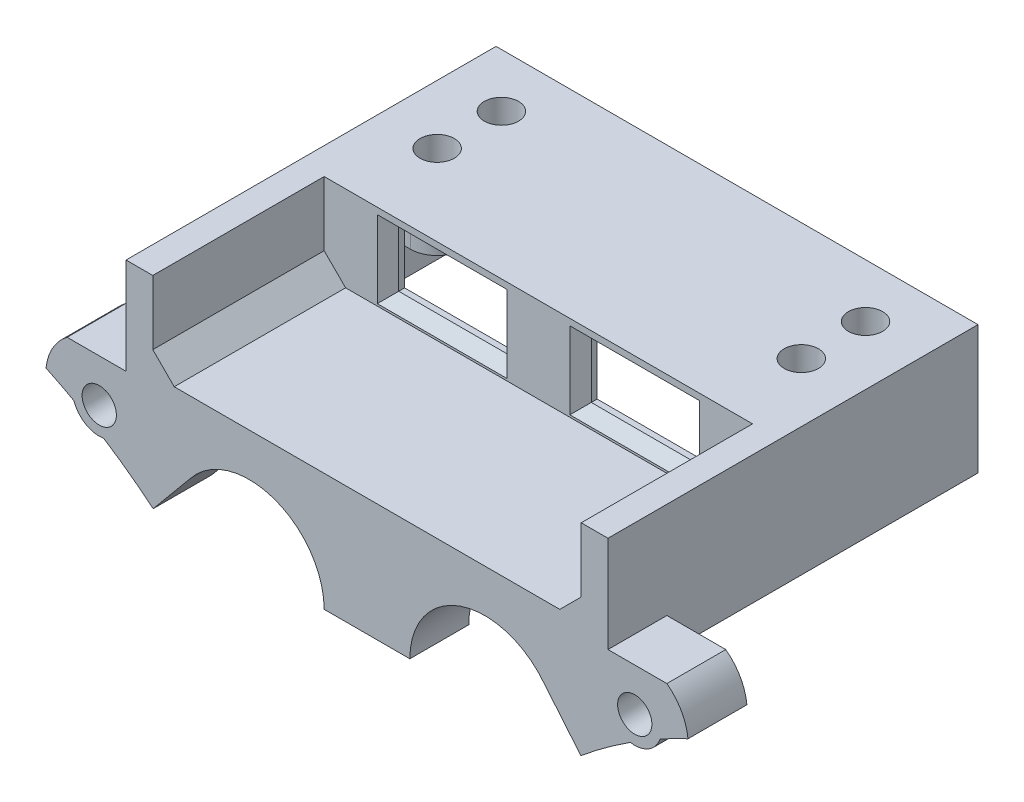
from build123d import *

# Parameters (mm, degrees)
EXTRUDE_1_DEPTH     = 34.55
SKETCH_2_W          = 40
SKETCH_2_H          = 8
CUT_EXTRUDE_1_DEPTH = 16
CUT_EXTRUDE_2_DEPTH = 10
SKETCH_4_W          = 10.1
SKETCH_4_H          = 5.2
CUT_EXTRUDE_3_DEPTH = 10
CHAMFER_1_SIZE      = 2
CHAMFER_2_SIZE      = 1
SKETCH_6_R          = 1.6
EXTRUDE_2_DEPTH     = 6.9
SKETCH_7_R          = 1.6
CUT_EXTRUDE_4_DEPTH = 10
SKETCH_8_R          = 1.6
EXTRUDE_3_DEPTH     = 5.5
SKETCH_10_W         = 40
SKETCH_10_H         = 10
CUT_EXTRUDE_5_DEPTH = 2
CUT_EXTRUDE_6_DEPTH = 10


with BuildPart() as part:
    # 草图1 → 凸台-拉伸1 (new body)
    with BuildSketch(Plane.XY):
        Polygon((0, 0), (22.5, 0), (22.5, 12), (-22.5, 12), (-22.5, 0), align=None)
    extrude(amount=EXTRUDE_1_DEPTH)

    # 草图2 → 切除-拉伸1 (cut)
    with BuildSketch(Plane.XY.offset(34.55)):
        with Locations((0, 8)):
            Rectangle(SKETCH_2_W, SKETCH_2_H)
    extrude(amount=-CUT_EXTRUDE_1_DEPTH, mode=Mode.SUBTRACT)

    # 草图3 → 切除-拉伸2 (cut)
    with BuildSketch(Plane.XZ):
        Polygon((0, 2), (20, 2), (20, 17), (-20, 17), (-20, 2), align=None)
    extrude(amount=-CUT_EXTRUDE_2_DEPTH, mode=Mode.SUBTRACT)

    # 草图4 → 切除-拉伸3 (cut)
    with BuildSketch(Plane.XY.offset(18.55)):
        with Locations((-8.99, 7.8)):
            Rectangle(SKETCH_4_W, SKETCH_4_H)
        with Locations((8.99, 7.8)):
            Rectangle(SKETCH_4_W, SKETCH_4_H)
    extrude(amount=-CUT_EXTRUDE_3_DEPTH, mode=Mode.SUBTRACT)

    # 倒角1
    chamfer_1_edges = [part.edges().sort_by_distance(p)[0] for p in [
        (20, 4, 26.55),
        (-20, 4, 26.55),
    ]]
    chamfer(chamfer_1_edges, length=CHAMFER_1_SIZE)

    # 倒角2
    chamfer_2_edges = [part.edges().sort_by_distance(p)[0] for p in [
        (-8.99, 5.2, 18.55),
        (-14.04, 7.8, 18.55),
        (-8.99, 10.4, 18.55),
        (-3.94, 7.8, 18.55),
        (8.99, 10.4, 18.55),
        (3.94, 7.8, 18.55),
        (8.99, 5.2, 18.55),
        (14.04, 7.8, 18.55),
    ]]
    chamfer(chamfer_2_edges, length=CHAMFER_2_SIZE)

    # 草图6 → 凸台-拉伸2 (add)
    # profile 1 of 2: a face of its own
    with BuildSketch(Plane(origin=(0, 12, 0), x_dir=(1, 0, 0), z_dir=(0, 1, 0))):
        with BuildLine():
            Line((22.5, 0), (22.5, -13.5))
            Line((22.5, -13.5), (17, -13.5))
            ThreePointArc((17, -13.5), (15.232233047, -12.767766953), (14.5, -11))
            Line((14.5, -11), (14.5, -5))
            Line((14.5, -5), (14.5, 0))
            Line((14.5, 0), (22.5, 0))
        make_face()
        with Locations((17, -5)):
            Circle(SKETCH_6_R, mode=Mode.SUBTRACT)
        with Locations((17, -11)):
            Circle(SKETCH_6_R, mode=Mode.SUBTRACT)
    # profile 2 of 2: a face of its own
    with BuildSketch(Plane(origin=(0, 12, 0), x_dir=(1, 0, 0), z_dir=(0, 1, 0))):
        with BuildLine():
            Line((-14.5, 0), (-22.5, 0))
            Line((-22.5, 0), (-22.5, -13.5))
            Line((-22.5, -13.5), (-17, -13.5))
            ThreePointArc((-17, -13.5), (-15.232233047, -12.767766953), (-14.5, -11))
            Line((-14.5, -11), (-14.5, -5))
            Line((-14.5, -5), (-14.5, 0))
        make_face()
        with Locations((-17, -11)):
            Circle(SKETCH_6_R, mode=Mode.SUBTRACT)
        with Locations((-17, -5)):
            Circle(SKETCH_6_R, mode=Mode.SUBTRACT)
    extrude(amount=-EXTRUDE_2_DEPTH)

    # 草图7 → 切除-拉伸4 (cut)
    with BuildSketch(Plane(origin=(0, 12, 0), x_dir=(1, 0, 0), z_dir=(0, 1, 0))):
        with Locations((17, -5)):
            Circle(SKETCH_7_R)
        with Locations((17, -11)):
            Circle(SKETCH_7_R)
        with Locations((-17, -5)):
            Circle(SKETCH_7_R)
        with Locations((-17, -11)):
            Circle(SKETCH_7_R)
    extrude(amount=-CUT_EXTRUDE_4_DEPTH, mode=Mode.SUBTRACT)

    # 草图8 → 凸台-拉伸3 (add)
    with BuildSketch(Plane.XY.offset(34.55)):
        with BuildLine():
            Line((1.843049286, -25.367101461), (9.230566594, -19.615105309))
            ThreePointArc((9.230566594, -19.615105309), (9.814108465, -18.625953935), (10.421644381, -17.651355727))
            Line((10.421644381, -17.651355727), (5.476763257, -11.300448334))
            ThreePointArc((5.476763257, -11.300448334), (6.699551666, -1.476763257), (16.523236743, -2.699551666))
            Line((16.523236743, -2.699551666), (19.967990067, -6.846461039))
            ThreePointArc((19.967990067, -6.846461039), (22.224318463, -5.085470923), (24.58365332, -3.465087309))
            ThreePointArc((24.58365332, -3.465087309), (26.278709649, -3.148232211), (27.365383934, -1.809295278))
            ThreePointArc((27.365383934, -1.809295278), (28.658809968, -1.124546474), (29.972928279, -0.480399834))
            ThreePointArc((29.972928279, -0.480399834), (29.349734714, 1.46572665), (28, 3))
            Line((28, 3), (22.5, 3))
            Line((22.5, 3), (22.5, 4))
            Line((22.5, 4), (-22.5, 4))
            Line((-22.5, 4), (-22.5, 3))
            Line((-22.5, 3), (-28, 3))
            ThreePointArc((-28, 3), (-29.349734714, 1.46572665), (-29.972928279, -0.480399834))
            ThreePointArc((-29.972928279, -0.480399834), (-28.658809968, -1.124546474), (-27.365383934, -1.809295278))
            ThreePointArc((-27.365383934, -1.809295278), (-26.278709649, -3.148232211), (-24.58365332, -3.465087309))
            ThreePointArc((-24.58365332, -3.465087309), (-22.224318463, -5.085470923), (-19.967990067, -6.846461039))
            Line((-19.967990067, -6.846461039), (-16.523236743, -2.699551666))
            ThreePointArc((-16.523236743, -2.699551666), (-6.699551666, -1.476763257), (-5.476763257, -11.300448334))
            Line((-5.476763257, -11.300448334), (-10.421644381, -17.651355727))
            ThreePointArc((-10.421644381, -17.651355727), (-9.814108465, -18.625953935), (-9.230566594, -19.615105309))
            Line((-9.230566594, -19.615105309), (-1.843049286, -25.367101461))
            ThreePointArc((-1.843049286, -25.367101461), (0, -26), (1.843049286, -25.367101461))
        make_face()
        with Locations((25, -1)):
            Circle(SKETCH_8_R, mode=Mode.SUBTRACT)
        with Locations((0, -23)):
            Circle(SKETCH_8_R, mode=Mode.SUBTRACT)
        with Locations((-25, -1)):
            Circle(SKETCH_8_R, mode=Mode.SUBTRACT)
    extrude(amount=-EXTRUDE_3_DEPTH)

    # 草图10 → 切除-拉伸5 (cut)
    with BuildSketch(Plane(origin=(0, 0, 0), x_dir=(-1, 0, 0), z_dir=(0, 0, -1))):
        with Locations((0, 5)):
            Rectangle(SKETCH_10_W, SKETCH_10_H)
    extrude(amount=-CUT_EXTRUDE_5_DEPTH, mode=Mode.SUBTRACT)

    # 草图11 → 切除-拉伸6 (cut)
    with BuildSketch(Plane(origin=(0, 0, 29.05), x_dir=(-1, 0, 0), z_dir=(0, 0, -1))):
        Polygon((-4, -7), (4, -7), (10.421644381, -17.651355727), (10.421644381, -27.0891889), (-10.421644381, -27.0891889), (-10.421644381, -17.651355727), align=None)
    extrude(amount=-CUT_EXTRUDE_6_DEPTH, mode=Mode.SUBTRACT)


solid = part.part
